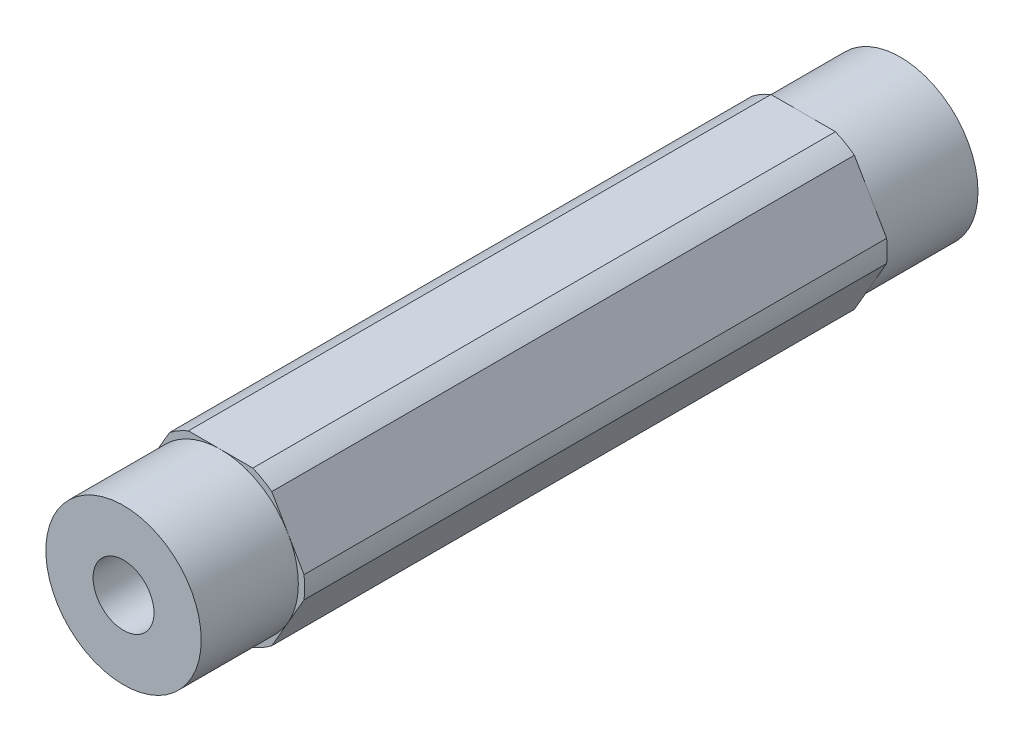
from build123d import *

# Parameters (mm, degrees)
SKETCH1_R           = 2.4892
BOSS_EXTRUDE1_DEPTH = 31.75
CUT_EXTRUDE2_DEPTH  = 7.9375


with BuildPart() as part:
    # Sketch1 → Boss-Extrude1 (new, symmetric)
    with BuildSketch(Plane.XY):
        with BuildLine():
            ThreePointArc((-2.634980936, 6.35), (-3.437499983, 5.953924622), (-4.181770846, 5.456960429))
            Line((-4.181770846, 5.456960429), (-6.816751782, 0.893039571))
            ThreePointArc((-6.816751782, 0.893039571), (-6.874999966, 0), (-6.816751782, -0.893039571))
            Line((-6.816751782, -0.893039571), (-4.181770846, -5.456960429))
            ThreePointArc((-4.181770846, -5.456960429), (-3.437499983, -5.953924622), (-2.634980936, -6.35))
            Line((-2.634980936, -6.35), (2.634980936, -6.35))
            ThreePointArc((2.634980936, -6.35), (3.437499983, -5.953924622), (4.181770846, -5.456960429))
            Line((4.181770846, -5.456960429), (6.816751782, -0.893039571))
            ThreePointArc((6.816751782, -0.893039571), (6.860422465, -0.447468582), (6.874999966, 0))
            ThreePointArc((6.874999966, 0), (6.860422465, 0.447468582), (6.816751782, 0.893039571))
            Line((6.816751782, 0.893039571), (4.181770846, 5.456960429))
            ThreePointArc((4.181770846, 5.456960429), (3.437499983, 5.953924622), (2.634980936, 6.35))
            Line((2.634980936, 6.35), (-2.634980936, 6.35))
        make_face()
        Circle(SKETCH1_R, mode=Mode.SUBTRACT)
    extrude(amount=BOSS_EXTRUDE1_DEPTH, both=True)

    # Sketch2 → Cut-Extrude2 (cut)
    with BuildSketch(Plane.XY.offset(31.75)):
        with BuildLine():
            ThreePointArc((5.499261354, 3.174999932), (6.35, -2.7e-08), (5.499261327, -3.174999977))
            Line((5.499261327, -3.174999977), (6.816751782, -0.893039571))
            ThreePointArc((6.816751782, -0.893039571), (6.874999966, 0), (6.816751782, 0.893039571))
            Line((6.816751782, 0.893039571), (5.499261354, 3.174999932))
        make_face()
        with BuildLine():
            ThreePointArc((1.8e-08, 6.35), (3.175000042, 5.49926129), (5.499261354, 3.174999932))
            Line((5.499261354, 3.174999932), (4.181770846, 5.456960429))
            ThreePointArc((4.181770846, 5.456960429), (3.437499983, 5.953924622), (2.634980936, 6.35))
            Line((2.634980936, 6.35), (1.8e-08, 6.35))
        make_face()
        with BuildLine():
            Line((4.181770846, -5.456960429), (5.499261327, -3.174999977))
            ThreePointArc((5.499261327, -3.174999977), (3.175000011, -5.499261308), (0, -6.35))
            Line((0, -6.35), (2.634980936, -6.35))
            ThreePointArc((2.634980936, -6.35), (3.437499983, -5.953924622), (4.181770846, -5.456960429))
        make_face()
        with BuildLine():
            ThreePointArc((-5.499261332, 3.174999968), (-3.175000008, 5.499261309), (1.8e-08, 6.35))
            Line((1.8e-08, 6.35), (-2.634980936, 6.35))
            ThreePointArc((-2.634980936, 6.35), (-3.437499983, 5.953924622), (-4.181770846, 5.456960429))
            Line((-4.181770846, 5.456960429), (-5.499261332, 3.174999968))
        make_face()
        with BuildLine():
            Line((-2.634980936, -6.35), (0, -6.35))
            ThreePointArc((0, -6.35), (-3.174999938, -5.49926135), (-5.499261242, -3.175000124))
            Line((-5.499261242, -3.175000124), (-4.181770846, -5.456960429))
            ThreePointArc((-4.181770846, -5.456960429), (-3.437499983, -5.953924622), (-2.634980936, -6.35))
        make_face()
        with BuildLine():
            ThreePointArc((-5.499261242, -3.175000124), (-6.35, -9e-08), (-5.499261332, 3.174999968))
            Line((-5.499261332, 3.174999968), (-6.816751782, 0.893039571))
            ThreePointArc((-6.816751782, 0.893039571), (-6.874999966, 0), (-6.816751782, -0.893039571))
            Line((-6.816751782, -0.893039571), (-5.499261242, -3.175000124))
        make_face()
    cut_extrude2 = extrude(amount=-CUT_EXTRUDE2_DEPTH, mode=Mode.SUBTRACT)

    # Mirror1: Cut-Extrude2 across plane
    add(cut_extrude2.mirror(Plane.XY), mode=Mode.SUBTRACT)


solid = part.part
